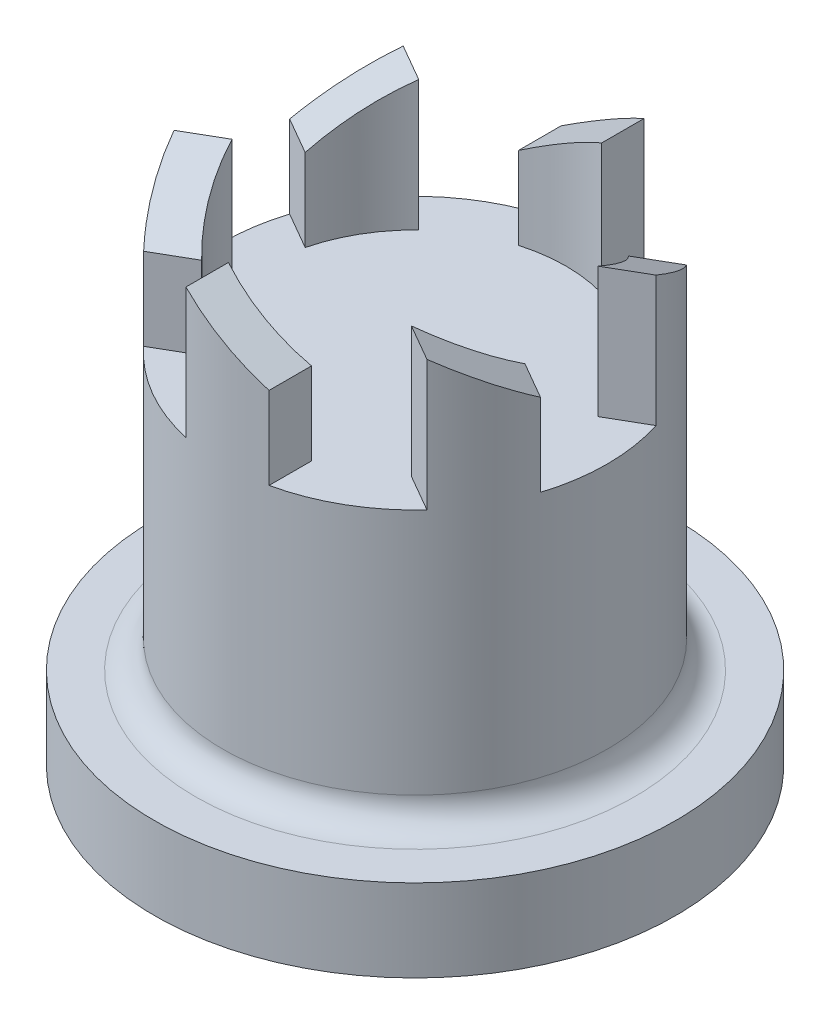
from build123d import *

# Parameters (mm, degrees)
SKETCH1_R           = 7
BOSS_EXTRUDE1_DEPTH = 10
BOSS_EXTRUDE3_DEPTH = 5
CHAMFER2_SIZE       = 2
CHAMFER2_SIZE_2     = 3.464101615
SKETCH7_R           = 9.5
BOSS_EXTRUDE4_DEPTH = 3
CUT_EXTRUDE1_DEPTH  = 10
FILLET1_R           = 1


with BuildPart() as part:
    # Sketch1 → Boss-Extrude1 (new body)
    with BuildSketch(Plane(origin=(0, 0, 0), x_dir=(1, 0, 0), z_dir=(0, 1, 0))):
        with Locations(Location((0, 0, 0), (0, 0, 270))):
            Circle(SKETCH1_R)
    extrude(amount=BOSS_EXTRUDE1_DEPTH)

    # Sketch5 → Boss-Extrude3 (add)
    with BuildSketch(Plane(origin=(0, 10, 0), x_dir=(1, 0, 0), z_dir=(0, 1, 0))):
        with BuildLine():
            Line((-3.821979409, 3.955056687), (-5.161555406, 4.72846125))
            ThreePointArc((-5.161555406, 4.72846125), (-6.062177826, 3.5), (-6.675745266, 2.10580748))
            Line((-6.675745266, 2.10580748), (-5.336169269, 1.332402917))
            ThreePointArc((-5.336169269, 1.332402917), (-4.763139721, 2.75), (-3.821979409, 3.955056687))
        make_face()
        with BuildLine():
            Line((1.51418986, 5.287459604), (1.51418986, 6.83426873))
            ThreePointArc((1.51418986, 6.83426873), (0, 7), (-1.51418986, 6.83426873))
            Line((-1.51418986, 6.83426873), (-1.51418986, 5.287459604))
            ThreePointArc((-1.51418986, 5.287459604), (0, 5.5), (1.51418986, 5.287459604))
        make_face()
        with BuildLine():
            ThreePointArc((6.675745266, 2.10580748), (6.062177826, 3.5), (5.161555406, 4.72846125))
            Line((5.161555406, 4.72846125), (3.821979409, 3.955056687))
            ThreePointArc((3.821979409, 3.955056687), (4.763139721, 2.75), (5.336169269, 1.332402917))
            Line((5.336169269, 1.332402917), (6.675745266, 2.10580748))
        make_face()
        with BuildLine():
            ThreePointArc((5.161555406, -4.72846125), (6.062177826, -3.5), (6.675745266, -2.10580748))
            Line((6.675745266, -2.10580748), (5.336169269, -1.332402917))
            ThreePointArc((5.336169269, -1.332402917), (4.763139721, -2.75), (3.821979409, -3.955056687))
            Line((3.821979409, -3.955056687), (5.161555406, -4.72846125))
        make_face()
        with BuildLine():
            ThreePointArc((-1.51418986, -6.83426873), (0, -7), (1.51418986, -6.83426873))
            Line((1.51418986, -6.83426873), (1.51418986, -5.287459604))
            ThreePointArc((1.51418986, -5.287459604), (0, -5.5), (-1.51418986, -5.287459604))
            Line((-1.51418986, -5.287459604), (-1.51418986, -6.83426873))
        make_face()
        with BuildLine():
            Line((-5.336169269, -1.332402917), (-6.675745266, -2.10580748))
            ThreePointArc((-6.675745266, -2.10580748), (-6.062177826, -3.5), (-5.161555406, -4.72846125))
            Line((-5.161555406, -4.72846125), (-3.821979409, -3.955056687))
            ThreePointArc((-3.821979409, -3.955056687), (-4.763139721, -2.75), (-5.336169269, -1.332402917))
        make_face()
    extrude(amount=BOSS_EXTRUDE3_DEPTH)

    # Chamfer2
    # the kernel refuses this chamfer: 3.464101615, 2 mm, written as the material it takes off along each edge
    with BuildSketch(Plane(origin=(-1.51418986, 15, -15.796196671), x_dir=(-0.05789386240267136, -0.9983227437537926, 0), z_dir=(0, 0, 1)), Plane(origin=(12.92281267, 15, -9.20942522), x_dir=(-0.02894693120133557, -0.9983227437537926, -0.05013755556391421), z_dir=(-0.8660254037844396, 0, 0.4999999999999985)), Plane(origin=(14.43700253, 15, 6.58677145), x_dir=(0.02894693120133555, -0.9983227437537926, -0.05013755556391386), z_dir=(-0.8660254037844383, 0, -0.5000000000000009)), Plane(origin=(1.51418986, 15, 15.796196671), x_dir=(0.05789386240267136, -0.9983227437537926, 0), z_dir=(0, 0, -1)), Plane(origin=(-12.92281267, 15, 9.20942522), x_dir=(0.028946931201335627, -0.9983227437537926, 0.05013755556391417), z_dir=(0.866025403784439, 0, -0.4999999999999995)), Plane(origin=(-14.43700253, 15, -6.58677145), x_dir=(-0.028946931201335666, -0.9983227437537926, 0.05013755556391416), z_dir=(0.8660254037844386, 0, 0.5000000000000002))) as chamfer2_piece_1:
        Polygon((CHAMFER2_SIZE * 0.998322743754, CHAMFER2_SIZE * 0.0578938624027), (-CHAMFER2_SIZE_2 * 0.057893862405, CHAMFER2_SIZE_2 * 0.998322743793), (0, 0), align=None)
    extrude(amount=19.470665008, mode=Mode.SUBTRACT)

    # Sketch7 → Boss-Extrude4 (add)
    with BuildSketch(Plane.XZ):
        with Locations(Location((0, 0, 0), (0, 0, 270))):
            Circle(SKETCH7_R)
    extrude(amount=BOSS_EXTRUDE4_DEPTH)

    # Sketch6 → Cut-Extrude1 (cut)
    with BuildSketch(Plane.XZ.offset(3)):
        with BuildLine():
            Line((1.224744871, 1.25), (-1.224744871, 1.25))
            ThreePointArc((-1.224744871, 1.25), (0, -1.75), (1.224744871, 1.25))
        make_face()
    extrude(amount=-CUT_EXTRUDE1_DEPTH, mode=Mode.SUBTRACT)

    # Fillet1
    fillet1_edges = [part.edges().sort_by_distance(p)[0] for p in [
        (0, 0, -7),
    ]]
    fillet(fillet1_edges, radius=FILLET1_R)


solid = part.part
